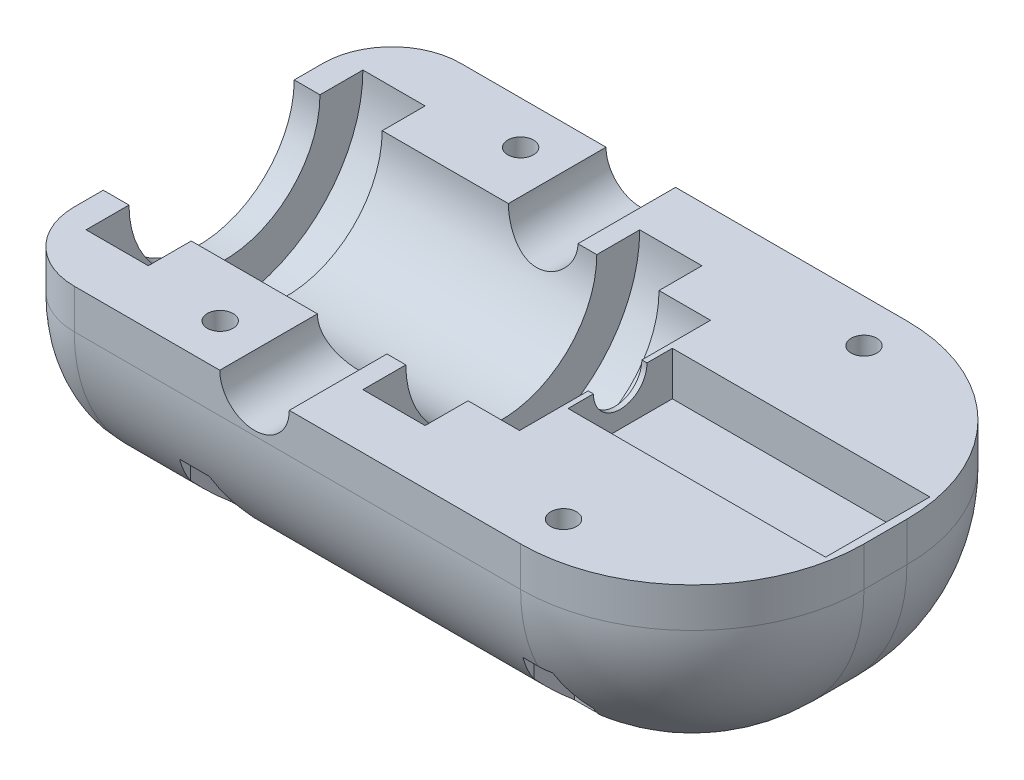
from build123d import *

# Parameters (mm, degrees)
SKETCH1_W           = 80
SKETCH1_H           = 45
BOSS_EXTRUDE1_DEPTH = 24.6
SKETCH3_W           = 30
SKETCH3_H           = 12.15
CUT_EXTRUDE1_DEPTH  = 5.1
SKETCH4_R           = 4.05
CUT_EXTRUDE2_DEPTH  = 66.039680196
SKETCH5_R           = 1.5
CUT_EXTRUDE3_DEPTH  = 31
FILLET1_START       = -40
FILLET1_DEPTH       = 80
FILLET2_R           = 20
CUT_EXTRUDE4_DEPTH  = 14
FILLET3_R           = 8


with BuildPart() as part:
    # Sketch1 → Boss-Extrude1 (new body)
    with BuildSketch(Plane(origin=(0, 0, 0), x_dir=(1, 0, 0), z_dir=(0, 1, 0))):
        Rectangle(SKETCH1_W, SKETCH1_H)
    extrude(amount=BOSS_EXTRUDE1_DEPTH)

    # Sketch2 → Cut-Revolve1 (revolve, cut)
    with BuildSketch(Plane(origin=(0, 24.6, 0), x_dir=(1, 0, 0), z_dir=(0, 1, 0))):
        Polygon((8.5, 3.125), (9.5, 3.125), (9.5, 0), (6, 0), (-40, 0), (-40, 11.125), (-37, 11.125), (-37, 16.125), (-29.75, 16.125), (-29.75, 11.125), (-4.75, 11.125), (-4.75, 16.125), (2.5, 16.125), (2.5, 11.125), (8.5, 11.125), align=None)
    revolve(axis=Axis((-40, 24.6, 0), (1, 0, 0)), mode=Mode.SUBTRACT)

    # Sketch3 → Cut-Extrude1 (cut)
    with BuildSketch(Plane(origin=(0, 24.6, 0), x_dir=(1, 0, 0), z_dir=(0, 1, 0))):
        with Locations((24.1, 0)):
            Rectangle(SKETCH3_W, SKETCH3_H)
    extrude(amount=-CUT_EXTRUDE1_DEPTH, mode=Mode.SUBTRACT)

    # Sketch4 → Cut-Extrude2 (cut, through all)
    with BuildSketch(Plane.XY.offset(22.5)):
        with Locations((-11, 24.6)):
            Circle(SKETCH4_R)
    extrude(amount=-CUT_EXTRUDE2_DEPTH, mode=Mode.SUBTRACT)

    # Sketch5 → Cut-Extrude3 (cut)
    with BuildSketch(Plane(origin=(0, 24.6, 0), x_dir=(1, 0, 0), z_dir=(0, 1, 0))):
        with Locations(Location((-20, 17.5, 0), (0, 0, 270))):
            Circle(SKETCH5_R)
        with Locations(Location((-20, -17.5, 0), (0, 0, 270))):
            Circle(SKETCH5_R)
        with Locations(Location((20, -17.5, 0), (0, 0, 270))):
            Circle(SKETCH5_R)
        with Locations(Location((20, 17.5, 0), (0, 0, 270))):
            Circle(SKETCH5_R)
    extrude(amount=-CUT_EXTRUDE3_DEPTH, mode=Mode.SUBTRACT)

    # Fillet1: read off the stored shape, not the designer's step
    # Fillet1 outline → Fillet1 (cut)
    with BuildSketch(Plane.YZ.offset(FILLET1_START)):
        with BuildLine():
            Line((0, 22.5), (0, 2.5))
            ThreePointArc((0, 2.5), (5.857864376, 16.642135624), (20, 22.5))
            Line((20, 22.5), (0, 22.5))
        make_face()
        with BuildLine():
            ThreePointArc((20, -22.5), (5.857864376, -16.642135624), (0, -2.5))
            Line((0, -2.5), (0, -22.5))
            Line((0, -22.5), (20, -22.5))
        make_face()
    extrude(amount=FILLET1_DEPTH, mode=Mode.SUBTRACT)

    # Fillet2
    # the kernel refuses this fillet: 20 mm, written as the material it takes off along each edge
    with BuildSketch(Plane(origin=(40, 0, 2.5), x_dir=(0, 1, 0), z_dir=(0, 0, -1))) as fillet2_piece_1:
        with BuildLine():
            CenterArc((FILLET2_R, -FILLET2_R), FILLET2_R, 90, 90)
            Line((0, -FILLET2_R), (0, 0))
            Line((0, 0), (FILLET2_R, 0))
        make_face()
    extrude(amount=5, mode=Mode.SUBTRACT)
    with BuildSketch(Plane(origin=(40, 19.999999999, 2.500000001), x_dir=(0, -1.0, -4.592977109962882e-11), z_dir=(0, 4.592977109962882e-11, -1.0))) as fillet2_piece_2:
        with BuildLine():
            CenterArc((19.999999999 - FILLET2_R, FILLET2_R), FILLET2_R, 270, 90)
            Line((19.999999999 - FILLET2_R, 0), (19.999999999, 0))
            Line((19.999999999, 0), (19.999999999, FILLET2_R))
        make_face()
    revolve(axis=Axis((40, 19.999999999, 2.500000001), (-1, 0, 0)), revolution_arc=90.000000005, mode=Mode.SUBTRACT)
    with BuildSketch(Plane(origin=(40, 19.999999999, -2.500000001), x_dir=(0, 4.592966007732635e-11, -1.0), z_dir=(0, 1.0, 4.592966007732635e-11))) as fillet2_piece_3:
        with BuildLine():
            CenterArc((19.999999999 - FILLET2_R, FILLET2_R), FILLET2_R, 270, 90)
            Line((19.999999999, FILLET2_R), (19.999999999, 0))
            Line((19.999999999, 0), (19.999999999 - FILLET2_R, 0))
        make_face()
    revolve(axis=Axis((40, 19.999999999, -2.500000001), (-1, 0, 0)), revolution_arc=90.000000005, mode=Mode.SUBTRACT)
    with BuildSketch(Plane(origin=(40, 20, 22.5), x_dir=(-1, 0, 0), z_dir=(0, 1, 0)), Plane(origin=(40, 20, -22.5), x_dir=(0, 0, 1), z_dir=(0, 1, 0))) as fillet2_piece_4:
        with BuildLine():
            CenterArc((FILLET2_R, -FILLET2_R), FILLET2_R, 90, 90)
            Line((0, -FILLET2_R), (0, 0))
            Line((0, 0), (FILLET2_R, 0))
        make_face()
    extrude(amount=54.6, mode=Mode.SUBTRACT)

    # Sketch6 → Cut-Extrude4 (cut)
    with BuildSketch(Plane.XZ):
        Polygon((21.732050808, 20.5), (18.267949192, 20.5), (16.535898385, 17.5), (18.267949192, 14.5), (21.732050808, 14.5), (23.464101615, 17.5), align=None)
        Polygon((-18.267949192, 20.5), (-21.732050808, 20.5), (-23.464101615, 17.5), (-21.732050808, 14.5), (-18.267949192, 14.5), (-16.535898385, 17.5), align=None)
        Polygon((-18.267949192, -14.5), (-21.732050808, -14.5), (-23.464101615, -17.5), (-21.732050808, -20.5), (-18.267949192, -20.5), (-16.535898385, -17.5), align=None)
        Polygon((21.732050808, -14.5), (18.267949192, -14.5), (16.535898385, -17.5), (18.267949192, -20.5), (21.732050808, -20.5), (23.464101615, -17.5), align=None)
    extrude(amount=-CUT_EXTRUDE4_DEPTH, mode=Mode.SUBTRACT)

    # Fillet3
    fillet3_edges = [part.edges().sort_by_distance(p)[0] for p in [
        (-40, 0, 0),
        (-40, 5.857864376, 16.642135624),
        (-40, 5.857864376, -16.642135624),
        (-40, 22.3, 22.5),
        (-40, 22.3, -22.5),
    ]]
    fillet(fillet3_edges, radius=FILLET3_R)


solid = part.part
